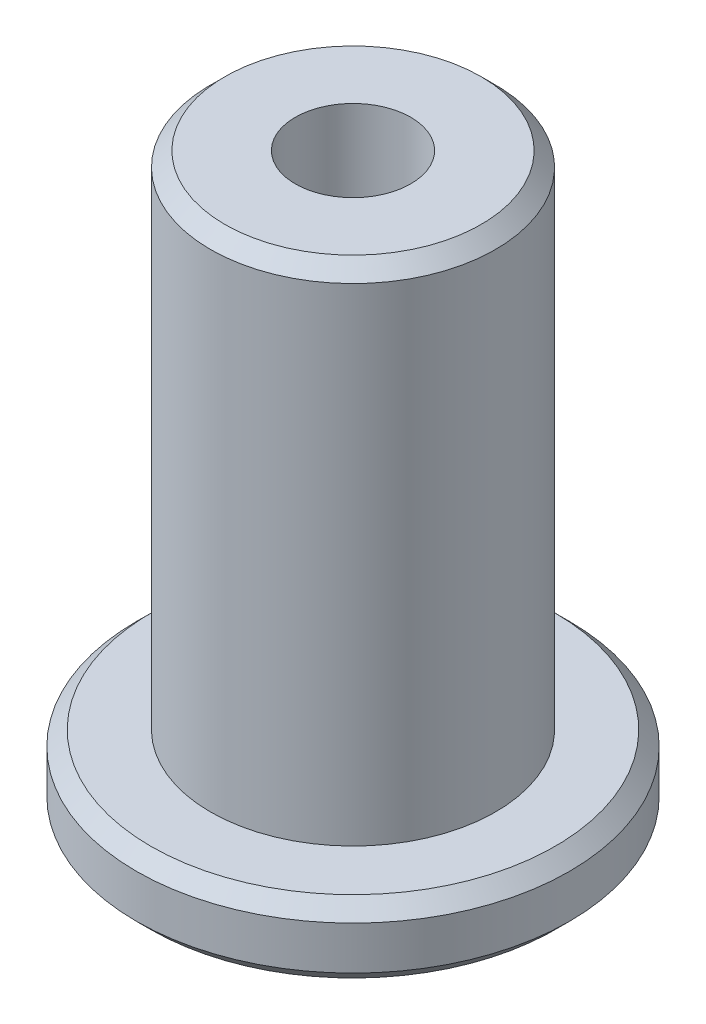
from build123d import *

# Parameters (mm, degrees)
SKETCH1_R                      = 6
BOSS_EXTRUDE1_DEPTH            = 2
SKETCH2_R                      = 3.95
BOSS_EXTRUDE2_DEPTH            = 13.9
CHAMFER1_SIZE                  = 0.4
CBORE_FOR_M3_SHCS1_D           = 3.2
CBORE_FOR_M3_SHCS1_CBORE_D     = 6
CBORE_FOR_M3_SHCS1_CBORE_DEPTH = 2.5


with BuildPart() as part:
    # Sketch1 → Boss-Extrude1 (new body)
    with BuildSketch(Plane(origin=(0, 0, 0), x_dir=(1, 0, 0), z_dir=(0, 1, 0))):
        Circle(SKETCH1_R)
    extrude(amount=BOSS_EXTRUDE1_DEPTH)

    # Sketch2 → Boss-Extrude2 (add)
    with BuildSketch(Plane(origin=(0, 2, 0), x_dir=(1, 0, 0), z_dir=(0, 1, 0))):
        Circle(SKETCH2_R)
    extrude(amount=BOSS_EXTRUDE2_DEPTH)

    # Chamfer1
    chamfer1_edges = [part.edges().sort_by_distance(p)[0] for p in [
        (-6, 0, 0),
        (-6, 2, 0),
        (-3.95, 15.9, 0),
    ]]
    chamfer(chamfer1_edges, length=CHAMFER1_SIZE)

    # CBORE for M3 SHCS1 (through all)
    with Locations(Plane(origin=(0, 0, 0), x_dir=(-1, 0, 0), z_dir=(0, -1, 0))):
        with Locations((0, 0)):
            CounterBoreHole(CBORE_FOR_M3_SHCS1_D / 2, CBORE_FOR_M3_SHCS1_CBORE_D / 2, CBORE_FOR_M3_SHCS1_CBORE_DEPTH)


solid = part.part
